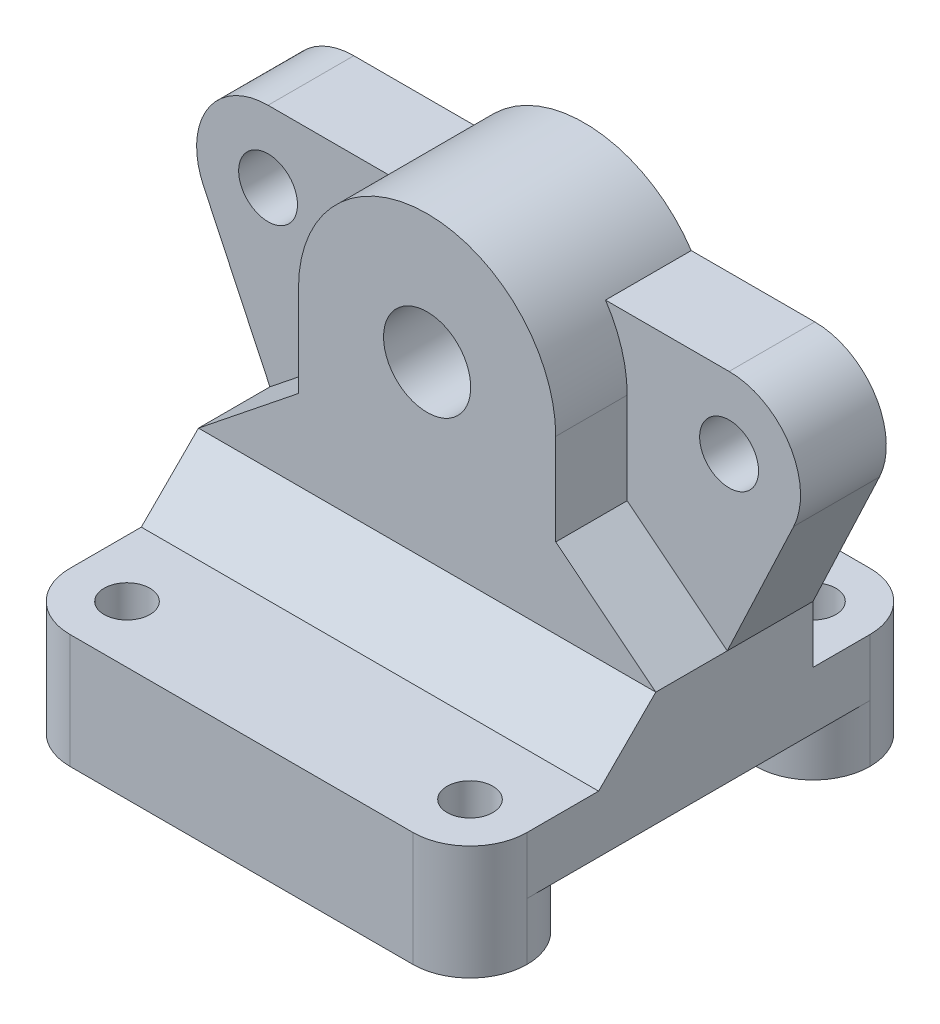
from build123d import *
from OCP.BRepFilletAPI import BRepFilletAPI_MakeChamfer
from build123d.topology import SkipClean

# Parameters (mm, degrees)
SKETCH1_R                = 1.6
SKETCH1_W                = 16
SKETCH1_H                = 16
BOSS_EXTRUDE1_DEPTH      = 8
SKETCH2_W                = 16
SKETCH2_H                = 4
CUT_EXTRUDE1_DEPTH       = 40
FILLET1_R                = 4
BOSS_EXTRUDE5_DEPTH      = 12
BOSS_EXTRUDE5_DEPTH_BACK = 1
SKETCH3_W                = 32
SKETCH3_H                = 5
CHAMFER1_SIZE            = 3
CHAMFER2_SIZE            = 8
CHAMFER2_SIZE2           = 10
SKETCH5_W                = 12
SKETCH5_H                = 5
BOSS_EXTRUDE7_DEPTH      = 8
FILLET2_R                = 4
SKETCH6_R                = 1.6
CUT_EXTRUDE2_DEPTH       = 20
SKETCH7_R                = 3.05
CUT_EXTRUDE3_DEPTH       = 9
SKETCH8_R                = 3.05
BOSS_EXTRUDE8_DEPTH      = 5
BOSS_EXTRUDE9_START      = -5
SKETCH9_R                = 1.6
BOSS_EXTRUDE9_DEPTH      = 5
SKETCH10_R               = 5.55
CUT_EXTRUDE4_DEPTH       = 9
BOSS_EXTRUDE11_START     = 6
SKETCH11_R               = 5.55
BOSS_EXTRUDE11_DEPTH     = 6
SKETCH12_R               = 7.71946315
SKETCH12_R_2             = 3.05
BOSS_EXTRUDE12_DEPTH     = 5.5
SKETCH14_R               = 7
CUT_EXTRUDE6_DEPTH       = 1.5
CUT_EXTRUDE8_DEPTH       = 5
BOSS_EXTRUDE13_START     = -6
SKETCH19_R               = 2.06
SKETCH19_R_2             = 7
BOSS_EXTRUDE13_DEPTH     = 6
CUT_EXTRUDE9_DEPTH       = 8
FILLET3_R                = 2
CHAMFER3_SIZE            = 4


# Some blends are built 0.0001 mm under size
with BuildPart() as part:
    # Sketch1 → Boss-Extrude1 (new body)
    with BuildSketch(Plane(origin=(0, 0, 0), x_dir=(1, 0, 0), z_dir=(0, 1, 0))):
        with BuildLine():
            Line((-12, 16), (12, 16))
            ThreePointArc((12, 16), (14.828427125, 14.828427125), (16, 12))
            Line((16, 12), (16, -12))
            ThreePointArc((16, -12), (14.828427125, -14.828427125), (12, -16))
            Line((12, -16), (-12, -16))
            ThreePointArc((-12, -16), (-14.828427125, -14.828427125), (-16, -12))
            Line((-16, -12), (-16, 12))
            ThreePointArc((-16, 12), (-14.828427125, 14.828427125), (-12, 16))
        make_face()
        with Locations(Location((12, 12, 0), (0, 0, 270))):
            Circle(SKETCH1_R, mode=Mode.SUBTRACT)
        with Locations(Location((-12, 12, 0), (0, 0, 90))):
            Circle(SKETCH1_R, mode=Mode.SUBTRACT)
        with Locations(Location((12, -12, 0), (0, 0, 90))):
            Circle(SKETCH1_R, mode=Mode.SUBTRACT)
        with Locations(Location((-12, -12, 0), (0, 0, 270))):
            Circle(SKETCH1_R, mode=Mode.SUBTRACT)
        Rectangle(SKETCH1_W, SKETCH1_H, mode=Mode.SUBTRACT)
    extrude(amount=BOSS_EXTRUDE1_DEPTH)

    # Sketch2 → Cut-Extrude1 (cut)
    with BuildSketch(Plane(origin=(16, 0, 0), x_dir=(0, 0, -1), z_dir=(1, 0, 0))):
        with Locations((0, 2)):
            Rectangle(SKETCH2_W, SKETCH2_H)
    extrude(amount=-CUT_EXTRUDE1_DEPTH, mode=Mode.SUBTRACT)

    # Fillet1
    fillet1_edges = [part.edges().sort_by_distance(p)[0] for p in [
        (-16, 2, -8),
        (16, 2, -8),
        (-16, 2, 8),
        (16, 2, 8),
    ]]
    fillet(fillet1_edges, radius=FILLET1_R - 0.0001)  # a hair under: the kernel refuses the full size

    # Sketch3 → Boss-Extrude5 (add, two sides: drawn at the far end of the back side and taken through both)
    with BuildSketch(Plane(origin=(0, 8, 0), x_dir=(1, 0, 0), z_dir=(0, 1, 0)).offset(-BOSS_EXTRUDE5_DEPTH_BACK)):
        with Locations((0, 5.5)):
            Rectangle(SKETCH3_W, SKETCH3_H)
        with Locations((0, -5.5)):
            Rectangle(SKETCH3_W, SKETCH3_H)
    extrude(amount=BOSS_EXTRUDE5_DEPTH + BOSS_EXTRUDE5_DEPTH_BACK)

    # Chamfer1
    chamfer1_edges = [part.edges().sort_by_distance(p)[0] for p in [
        (8, 7, 5.5),
        (8, 7, -5.5),
        (-8, 7, -5.5),
        (-8, 7, 5.5),
    ]]
    chamfer(chamfer1_edges, length=CHAMFER1_SIZE - 0.0001)  # a hair under: the kernel refuses the full size

    # Chamfer2: one chamfer whose edges measure the first distance from different faces: ONE call of the kernel's chamfer builder (chamfer() names one face for all edges)
    chamfer2_edges_1 = [part.edges().sort_by_distance(p)[0] for p in [
        (-16, 20, -5.5),
        (-16, 20, 5.5),
    ]]
    chamfer2_side_1 = [part.faces().sort_by_distance(p)[0] for p in [
        (-16, 0.312409987, 11.99995),
    ]]
    chamfer2_edges_2 = [part.edges().sort_by_distance(p)[0] for p in [
        (16, 20, -5.5),
        (16, 20, 5.5),
    ]]
    chamfer2_side_2 = [part.faces().sort_by_distance(p)[0] for p in [
        (16, 0.312409987, -11.99995),
    ]]
    chamfer2 = BRepFilletAPI_MakeChamfer(part.part.solid().wrapped)
    for e in chamfer2_edges_1:
        chamfer2.Add(CHAMFER2_SIZE, CHAMFER2_SIZE2, e.wrapped, chamfer2_side_1[0].wrapped)  # the first distance lies on this face
    for e in chamfer2_edges_2:
        chamfer2.Add(CHAMFER2_SIZE, CHAMFER2_SIZE2, e.wrapped, chamfer2_side_2[0].wrapped)  # the first distance lies on this face
    add(Compound.cast(chamfer2.Shape()), mode=Mode.REPLACE)

    # Sketch5 → Boss-Extrude7 (add)
    with BuildSketch(Plane(origin=(0, 20, 0), x_dir=(1, 0, 0), z_dir=(0, 1, 0))):
        with Locations((0, 5.5)):
            Rectangle(SKETCH5_W, SKETCH5_H)
        with Locations((0, -5.5)):
            Rectangle(SKETCH5_W, SKETCH5_H)
    extrude(amount=BOSS_EXTRUDE7_DEPTH)

    # Fillet2
    fillet2_edges = [part.edges().sort_by_distance(p)[0] for p in [
        (-6, 28, -5.5),
        (6, 28, -5.5),
        (-6, 28, 5.5),
        (6, 28, 5.5),
    ]]
    fillet(fillet2_edges, radius=FILLET2_R)

    # Sketch6 → Cut-Extrude2 (cut)
    with BuildSketch(Plane.XY.offset(8)):
        with Locations((0, 24)):
            Circle(SKETCH6_R)
    extrude(amount=-CUT_EXTRUDE2_DEPTH, mode=Mode.SUBTRACT)

    # Sketch7 → Cut-Extrude3 (cut)
    with BuildSketch(Plane.XY.offset(8)):
        with Locations((0, 24)):
            Circle(SKETCH7_R)
    extrude(amount=-CUT_EXTRUDE3_DEPTH, mode=Mode.SUBTRACT)

    # Sketch8 → Boss-Extrude8 (add)
    with BuildSketch(Plane.XY.offset(8)):
        with BuildLine():
            Line((-9, 24), (-9, 15))
            Line((-9, 15), (0, 15))
            Line((0, 15), (9, 15))
            Line((9, 15), (9, 24))
            ThreePointArc((9, 24), (0, 33), (-9, 24))
        make_face()
        with Locations((0, 24)):
            Circle(SKETCH8_R, mode=Mode.SUBTRACT)
    extrude(amount=-BOSS_EXTRUDE8_DEPTH)

    # Sketch9 → Boss-Extrude9 (add)
    with BuildSketch(Plane(origin=(0, 0, -8), x_dir=(-1, 0, 0), z_dir=(0, 0, -1)).offset(BOSS_EXTRUDE9_START)):
        with BuildLine():
            Line((-9, 24), (-9, 11))
            Line((-9, 11), (9, 11))
            Line((9, 11), (9, 24))
            ThreePointArc((9, 24), (0, 33), (-9, 24))
        make_face()
        with Locations(Location((0, 24, 0), (0, 0, 180))):
            Circle(SKETCH9_R, mode=Mode.SUBTRACT)
    extrude(amount=BOSS_EXTRUDE9_DEPTH)

    # Sketch10 → Cut-Extrude4 (cut)
    with BuildSketch(Plane(origin=(0, 0, -8), x_dir=(-1, 0, 0), z_dir=(0, 0, -1))):
        with Locations((0, 24)):
            Circle(SKETCH10_R)
    extrude(amount=-CUT_EXTRUDE4_DEPTH, mode=Mode.SUBTRACT)

    # Sketch11 → Boss-Extrude11 (add)
    with SkipClean():  # the faces are left unmerged after this step: merging them gives an invalid solid
        with BuildSketch(Plane.XY.offset(-3).offset(BOSS_EXTRUDE11_START)):
            with BuildLine():
                Line((-9, 24), (-9, 17.6))
                Line((-9, 17.6), (-16, 12))
                Line((-16, 12), (-16, 8))
                Line((-16, 8), (-8, 8))
                Line((-8, 8), (-8, 4))
                Line((-8, 4), (-5, 7))
                Line((-5, 7), (5, 7))
                Line((5, 7), (8, 4))
                Line((8, 4), (8, 8))
                Line((8, 8), (16, 8))
                Line((16, 8), (16, 12))
                Line((16, 12), (9, 17.6))
                Line((9, 17.6), (9, 24))
                ThreePointArc((9, 24), (0, 33), (-9, 24))
            make_face()
            with Locations(Location((0, 24, 0), (0, 0, 180))):
                Circle(SKETCH11_R, mode=Mode.SUBTRACT)
        extrude(amount=-BOSS_EXTRUDE11_DEPTH)

    # Sketch12 → Boss-Extrude12 (add)
    with BuildSketch(Plane(origin=(0, 0, 3), x_dir=(-1, 0, 0), z_dir=(0, 0, -1))):
        with Locations((0, 24)):
            Circle(SKETCH12_R)
        with Locations(Location((0, 24, 0), (0, 0, 180))):
            Circle(SKETCH12_R_2, mode=Mode.SUBTRACT)
    extrude(amount=BOSS_EXTRUDE12_DEPTH)

    # Sketch14 → Cut-Extrude6 (cut)
    with BuildSketch(Plane(origin=(0, 0, -8), x_dir=(-1, 0, 0), z_dir=(0, 0, -1))):
        with Locations((0, 24)):
            Circle(SKETCH14_R)
    extrude(amount=-CUT_EXTRUDE6_DEPTH, mode=Mode.SUBTRACT)

    # Sketch16 → Cut-Extrude8 (cut)
    with SkipClean():  # the faces are left unmerged after this step: merging them gives an invalid solid
        with BuildSketch(Plane.XY.offset(8)):
            Polygon((-16, 8), (16, 8), (29.507054263, 32.870046285), (-4.901166162, 51.167615183), (-28.978076235, 29.234025221), align=None)
        extrude(amount=-CUT_EXTRUDE8_DEPTH, mode=Mode.SUBTRACT)

    # Sketch19 → Boss-Extrude13 (add)
    with SkipClean():  # the faces are left unmerged after this step: merging them gives an invalid solid
        with BuildSketch(Plane(origin=(0, 0, -8), x_dir=(-1, 0, 0), z_dir=(0, 0, -1)).offset(BOSS_EXTRUDE13_START)):
            with BuildLine():
                Line((16.13, 29), (7.483314774, 29))
                ThreePointArc((7.483314774, 29), (0, 33), (-7.483314774, 29))
                Line((-7.483314774, 29), (-16.13, 29))
                ThreePointArc((-16.13, 29), (-20.352655353, 26.677532777), (-20.652519245, 21.867672708))
                Line((-20.652519245, 21.867672708), (-16, 12))
                Line((-16, 12), (16, 12))
                Line((16, 12), (20.652519245, 21.867672708))
                ThreePointArc((20.652519245, 21.867672708), (20.352655353, 26.677532777), (16.13, 29))
            make_face()
            with Locations((16.13, 24)):
                Circle(SKETCH19_R, mode=Mode.SUBTRACT)
            with Locations(Location((-16.13, 24, 0), (0, 0, 180))):
                Circle(SKETCH19_R, mode=Mode.SUBTRACT)
            with Locations((0, 24)):
                Circle(SKETCH19_R_2, mode=Mode.SUBTRACT)
        extrude(amount=BOSS_EXTRUDE13_DEPTH)

    # Sketch21 → Cut-Extrude9 (cut)
    with SkipClean():  # the faces are left unmerged after this step: merging them gives an invalid solid
        with BuildSketch(Plane(origin=(0, 0, -16), x_dir=(-1, 0, 0), z_dir=(0, 0, -1))):
            with BuildLine():
                Line((8, 8), (0, 8))
                Line((0, 8), (0, 3))
                ThreePointArc((0, 3), (4.716990566, 4.352815094), (8, 8))
            make_face()
            with BuildLine():
                Line((0, 3), (0, 8))
                Line((0, 8), (-8, 8))
                ThreePointArc((-8, 8), (-4.716990566, 4.352815094), (0, 3))
            make_face()
        extrude(amount=-CUT_EXTRUDE9_DEPTH, mode=Mode.SUBTRACT)

    # Fillet3
    # the kernel refuses this fillet: 2 mm, written as the material it takes off along each edge
    with BuildSketch(Plane(origin=(8, 8, -18.912878475), x_dir=(1, 0, 0), z_dir=(0, 0, 1))) as fillet3_piece_1:
        with BuildLine():
            CenterArc((1.16515139, -2), FILLET3_R, 90, 57.22888336)
            ThreePointArc((-0.516527764, -0.917431193), (-0.244685814, -0.466360256), (0, 0))
            Line((0, 0), (1.16515139, 0))
        make_face()
    extrude(amount=10.912878475, mode=Mode.SUBTRACT)
    with BuildSketch(Plane(origin=(-8, 8, -18.912878475), x_dir=(-1, 0, 0), z_dir=(0, 0, 1))) as fillet3_piece_2:
        with BuildLine():
            CenterArc((1.16515139, 2), FILLET3_R, 212.77111664, 57.22888336)
            ThreePointArc((-0.516527764, 0.917431193), (-0.244685814, 0.466360256), (0, 0))
            Line((0, 0), (1.16515139, 0))
        make_face()
    extrude(amount=10.912878475, mode=Mode.SUBTRACT)

    # Chamfer3
    chamfer3_edges = [part.edges().sort_by_distance(p)[0] for p in [
        (0, 8, 3),
    ]]
    chamfer(chamfer3_edges, length=CHAMFER3_SIZE)


solid = part.part
